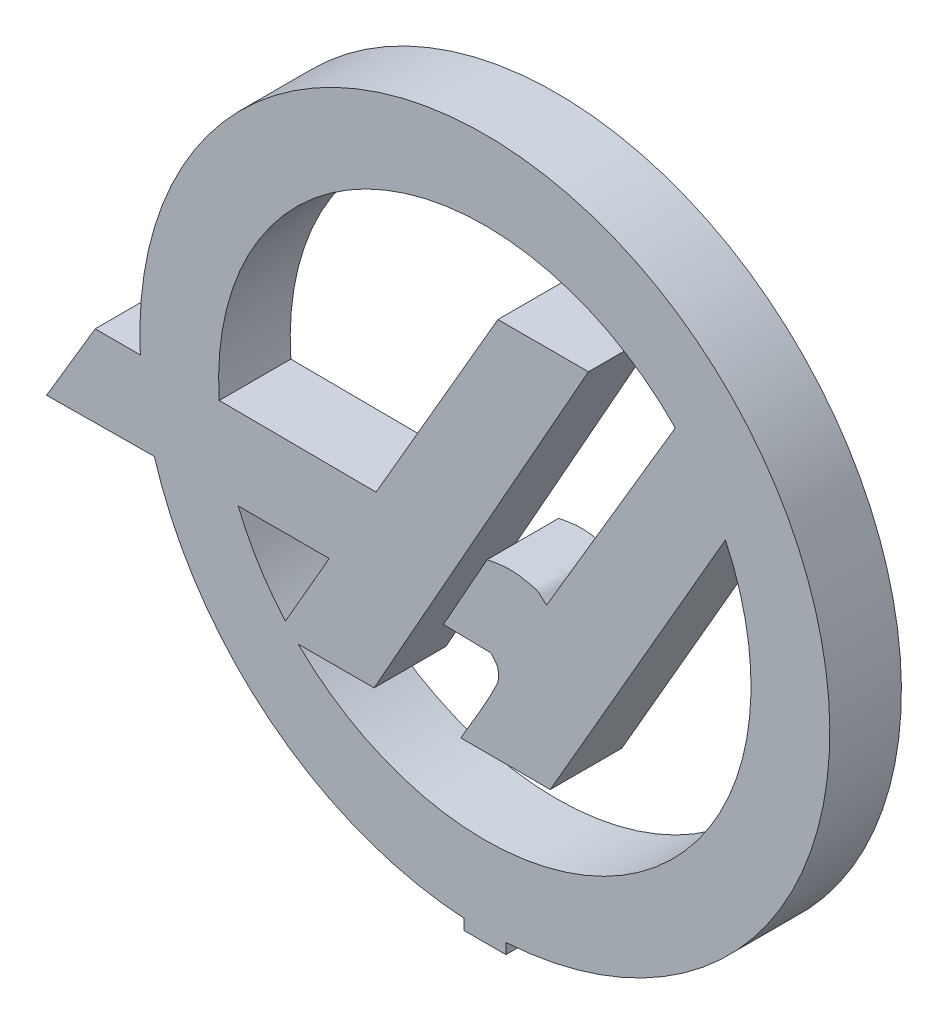
from build123d import *

# Parameters (mm, degrees)
BOSS_EXTRUDE1_DEPTH = 73.5
SCALE1_DEPTH        = 73.5
SCALE1_2_DEPTH      = 35.280051018
SCALE1_START        = 38.220051018
SCALE1_3_DEPTH      = 35.279948982
SCALE1_START_2      = 35.280051018
SCALE1_4_DEPTH      = 2.94


# Read off the part's stored shape, not the designer's step: Scale1
with BuildPart() as part:
    # Sketch1 → Boss-Extrude1 (new body)
    with BuildSketch(Plane.XY):
        with BuildLine():
            Line((6.806314099, 268.000000001), (117.455941573, 268.970996138))
            ThreePointArc((117.455941573, 268.970996138), (236.688217781, 93.24688451), (435.009033459, 17.324864215))
            Line((435.009033459, 17.324864215), (435.009033459, 6.459615702))
            Line((435.009033459, 6.459615702), (478.259031844, 6.459615702))
            Line((478.259031844, 6.459615702), (478.259031844, 17.324864314))
            ThreePointArc((478.259031844, 17.324864314), (692.344362554, 635.090638807), (103.00000551, 352))
            Line((103.00000551, 352), (56.640547879, 352))
            Line((56.640547879, 352), (6.806314099, 268.000000001))
        make_face()
        with BuildLine():
            ThreePointArc((251.884299831, 189.799453042), (224.339726467, 226.845833922), (203.423883848, 268.000000001))
            Line((203.423883848, 268.000000001), (297, 268.000000001))
            Line((297, 268.000000001), (251.884299831, 189.799453042))
        make_face(mode=Mode.SUBTRACT)
        with BuildLine():
            ThreePointArc((183.999999995, 352.000000012), (344.926101955, 620.204516968), (652.184505988, 561.696856288))
            Line((652.184505988, 561.696856288), (520, 338))
            add(Edge.make_bspline(
                [(520, 338), (516, 341), (512.856486558, 345.810656353), (508, 347), (483.294181497, 353.050404531), (477.851743634, 351.141957272), (459, 348)],
                knots=[0, 0, 0, 0, 1, 1, 1, 2, 2, 2, 2], degree=3))
            Line((459, 348), (414.15311107, 268.000000001))
            Line((414.15311107, 268.000000001), (463, 267))
            add(Edge.make_bspline(
                [(463, 267), (465.333333333, 263.666666667), (469.050440025, 260.956499894), (470, 257), (471.16945492, 252.127271165), (471.128314939, 246.536671316), (469, 242), (458.288028235, 219.166586501), (444.333333333, 198), (432, 176)],
                knots=[0, 0, 0, 0, 1, 1, 1, 2, 2, 2, 3, 3, 3, 3], degree=3))
            Line((432, 176), (523.783724069, 176))
            Line((523.783724069, 176), (703.607534398, 487.787583679))
            ThreePointArc((703.607534398, 487.787583679), (614.979125151, 148.065376335), (264.996930573, 175.96943637))
            Line((264.996930573, 175.96943637), (342.999405137, 176))
            Line((342.999405137, 176), (562.999999995, 567.000000012))
            Line((562.999999995, 567.000000012), (470.080751257, 567.000000012))
            Line((470.080751257, 567.000000012), (344.999999995, 351.000000012))
            Line((344.999999995, 351.000000012), (183.999999995, 352.000000012))
        make_face(mode=Mode.SUBTRACT)
    extrude(amount=BOSS_EXTRUDE1_DEPTH)

    # Scale1 outline → Scale1 (cut)
    # profile 1 of 3: a face of its own
    with BuildSketch(Plane.XY):
        with BuildLine():
            Line((56.640547879, 352), (6.806314099, 268.000000001))
            Line((6.806314099, 268.000000001), (117.455941573, 268.970996138))
            ThreePointArc((117.455941573, 268.970996138), (236.688217781, 93.24688451), (435.009033459, 17.324864215))
            Line((435.009033459, 17.324864215), (435.009033459, 6.459615702))
            Line((435.009033459, 6.459615702), (478.259031844, 6.459615702))
            Line((478.259031844, 6.459615702), (478.259031844, 17.324864314))
            ThreePointArc((478.259031844, 17.324864314), (692.344362554, 635.090638807), (103.00000551, 352))
            Line((103.00000551, 352), (56.640547879, 352))
        make_face()
        with BuildLine():
            Line((297, 268.000000001), (251.884299831, 189.799453042))
            ThreePointArc((251.884299831, 189.799453042), (224.339726467, 226.845833922), (203.423883848, 268.000000001))
            Line((203.423883848, 268.000000001), (297, 268.000000001))
        make_face(mode=Mode.SUBTRACT)
        with BuildLine():
            Line((342.999405137, 176), (440.814885411, 349.844315344))
            ThreePointArc((440.814885411, 349.844315344), (436.261690591, 353.400375377), (433.507038576, 358.478666261))
            Line((433.507038576, 358.478666261), (429.081053477, 358.439826415))
            Line((429.081053477, 358.439826415), (431.074422829, 361.799826415))
            Line((431.074422829, 361.799826415), (432.928801134, 361.799826415))
            ThreePointArc((432.928801134, 361.799826415), (439.934134004, 374.785953816), (454.686461757, 374.497823008))
            Line((454.686461757, 374.497823008), (562.999999995, 567.000000012))
            Line((562.999999995, 567.000000012), (470.080751257, 567.000000012))
            Line((470.080751257, 567.000000012), (344.999999995, 351.000000012))
            Line((344.999999995, 351.000000012), (183.999999995, 352.000000012))
            ThreePointArc((183.999999995, 352.000000012), (344.926101955, 620.204516968), (652.184505988, 561.696856288))
            Line((652.184505988, 561.696856288), (520, 338))
            add(Edge.make_bspline(
                [(520, 338), (516, 341), (512.856486558, 345.810656353), (508, 347), (483.294181497, 353.050404531), (477.851743634, 351.141957272), (459, 348)],
                knots=[0, 0, 0, 0, 1, 1, 1, 2, 2, 2, 2], degree=3))
            Line((459, 348), (414.15311107, 268.000000001))
            Line((414.15311107, 268.000000001), (463, 267))
            add(Edge.make_bspline(
                [(463, 267), (465.333333333, 263.666666667), (469.050440025, 260.956499894), (470, 257), (471.16945492, 252.127271165), (471.128314939, 246.536671316), (469, 242), (458.288028235, 219.166586501), (444.333333333, 198), (432, 176)],
                knots=[0, 0, 0, 0, 1, 1, 1, 2, 2, 2, 3, 3, 3, 3], degree=3))
            Line((432, 176), (523.783724069, 176))
            Line((523.783724069, 176), (703.607534398, 487.787583679))
            ThreePointArc((703.607534398, 487.787583679), (614.979125151, 148.065376335), (264.996930573, 175.96943637))
            Line((264.996930573, 175.96943637), (342.999405137, 176))
        make_face(mode=Mode.SUBTRACT)
    # profile 2 of 3: a face of its own
    with BuildSketch(Plane.XY):
        with BuildLine():
            ThreePointArc((436.945756267, 358.439826415), (437.782389972, 356.793659772), (438.884172907, 355.311804537))
            Line((438.884172907, 355.311804537), (440.688800913, 358.439826415))
            Line((440.688800913, 358.439826415), (436.945756267, 358.439826415))
        make_face()
    # profile 3 of 3: a face of its own
    with BuildSketch(Plane.XY):
        with BuildLine():
            Line((442.403869561, 352.668365901), (445.648100754, 358.434233932))
            Line((445.648100754, 358.434233932), (445.374925356, 358.439826415))
            Line((445.374925356, 358.439826415), (447.168800913, 361.639826415))
            add(Edge.make_bspline(
                [(447.481708826, 361.693046739), (447.386829266, 361.677100653), (447.284083229, 361.659040134), (447.168800913, 361.639826415)],
                knots=[1.847119824, 1.847119824, 1.847119824, 1.847119824, 2, 2, 2, 2], degree=3))
            Line((447.481708826, 361.693046739), (453.097477608, 371.673772451))
            ThreePointArc((453.097477608, 371.673772451), (441.566685859, 371.994170503), (436.168800913, 361.799826415))
            Line((436.168800913, 361.799826415), (442.608800913, 361.759826415))
            Line((442.608800913, 361.759826415), (447.612030964, 370.399826416))
            Line((447.612030964, 370.399826416), (451.328800913, 370.399826416))
            Line((451.328800913, 370.399826416), (442.528777119, 354.759826415))
            Line((442.528777119, 354.759826415), (439.408678136, 354.75860387))
            ThreePointArc((439.408678136, 354.75860387), (440.818355265, 353.587502585), (442.403869561, 352.668365901))
        make_face()
    extrude(amount=SCALE1_DEPTH, mode=Mode.SUBTRACT)

    # Scale1 2 outline → Scale1 2 (cut)
    # profile 1 of 2: a face of its own
    with BuildSketch(Plane.XY):
        with BuildLine():
            Line((445.374925356, 358.439826415), (445.648100754, 358.434233932))
            Line((445.648100754, 358.434233932), (447.481708826, 361.693046739))
            add(Edge.make_bspline(
                [(447.481708826, 361.693046739), (447.386829266, 361.677100653), (447.284083229, 361.659040134), (447.168800913, 361.639826415)],
                knots=[1.847119824, 1.847119824, 1.847119824, 1.847119824, 2, 2, 2, 2], degree=3))
            Line((447.168800913, 361.639826415), (445.374925356, 358.439826415))
        make_face()
    # profile 2 of 2: a face of its own
    with BuildSketch(Plane.XY):
        with BuildLine():
            Line((440.814885411, 349.844315344), (442.403869561, 352.668365901))
            ThreePointArc((442.403869561, 352.668365901), (440.818355265, 353.587502585), (439.408678136, 354.75860387))
            Line((439.408678136, 354.75860387), (442.528777119, 354.759826415))
            Line((442.528777119, 354.759826415), (451.328800913, 370.399826416))
            Line((451.328800913, 370.399826416), (447.612030964, 370.399826416))
            Line((447.612030964, 370.399826416), (442.608800913, 361.759826415))
            Line((442.608800913, 361.759826415), (436.168800913, 361.799826415))
            ThreePointArc((436.168800913, 361.799826415), (441.566685859, 371.994170503), (453.097477608, 371.673772451))
            Line((453.097477608, 371.673772451), (454.686461757, 374.497823008))
            ThreePointArc((454.686461757, 374.497823008), (439.934134004, 374.785953816), (432.928801134, 361.799826415))
            Line((432.928801134, 361.799826415), (431.074422829, 361.799826415))
            Line((431.074422829, 361.799826415), (429.081053477, 358.439826415))
            Line((429.081053477, 358.439826415), (433.507038576, 358.478666261))
            ThreePointArc((433.507038576, 358.478666261), (436.261690591, 353.400375377), (440.814885411, 349.844315344))
        make_face()
        with BuildLine():
            Line((440.688800913, 358.439826415), (438.884172907, 355.311804537))
            ThreePointArc((438.884172907, 355.311804537), (437.782389972, 356.793659772), (436.945756267, 358.439826415))
            Line((436.945756267, 358.439826415), (440.688800913, 358.439826415))
        make_face(mode=Mode.SUBTRACT)
    extrude(amount=SCALE1_2_DEPTH, mode=Mode.SUBTRACT)

    # Scale1 3 outline → Scale1 3 (cut)
    # profile 1 of 2: a face of its own
    with BuildSketch(Plane.XY.offset(SCALE1_START)):
        with BuildLine():
            Line((445.374925356, 358.439826415), (445.648100754, 358.434233932))
            Line((445.648100754, 358.434233932), (447.481708826, 361.693046739))
            add(Edge.make_bspline(
                [(447.481708826, 361.693046739), (447.386829266, 361.677100653), (447.284083229, 361.659040134), (447.168800913, 361.639826415)],
                knots=[1.847119824, 1.847119824, 1.847119824, 1.847119824, 2, 2, 2, 2], degree=3))
            Line((447.168800913, 361.639826415), (445.374925356, 358.439826415))
        make_face()
    # profile 2 of 2: a face of its own
    with BuildSketch(Plane.XY.offset(SCALE1_START)):
        with BuildLine():
            Line((440.814885411, 349.844315344), (442.403869561, 352.668365901))
            ThreePointArc((442.403869561, 352.668365901), (440.818355265, 353.587502585), (439.408678136, 354.75860387))
            Line((439.408678136, 354.75860387), (442.528777119, 354.759826415))
            Line((442.528777119, 354.759826415), (451.328800913, 370.399826416))
            Line((451.328800913, 370.399826416), (447.612030964, 370.399826416))
            Line((447.612030964, 370.399826416), (442.608800913, 361.759826415))
            Line((442.608800913, 361.759826415), (436.168800913, 361.799826415))
            ThreePointArc((436.168800913, 361.799826415), (441.566685859, 371.994170503), (453.097477608, 371.673772451))
            Line((453.097477608, 371.673772451), (454.686461757, 374.497823008))
            ThreePointArc((454.686461757, 374.497823008), (439.934134004, 374.785953816), (432.928801134, 361.799826415))
            Line((432.928801134, 361.799826415), (431.074422829, 361.799826415))
            Line((431.074422829, 361.799826415), (429.081053477, 358.439826415))
            Line((429.081053477, 358.439826415), (433.507038576, 358.478666261))
            ThreePointArc((433.507038576, 358.478666261), (436.261690591, 353.400375377), (440.814885411, 349.844315344))
        make_face()
        with BuildLine():
            Line((440.688800913, 358.439826415), (438.884172907, 355.311804537))
            ThreePointArc((438.884172907, 355.311804537), (437.782389972, 356.793659772), (436.945756267, 358.439826415))
            Line((436.945756267, 358.439826415), (440.688800913, 358.439826415))
        make_face(mode=Mode.SUBTRACT)
    extrude(amount=SCALE1_3_DEPTH, mode=Mode.SUBTRACT)

    # Scale1 4 outline → Scale1 4 (add)
    with BuildSketch(Plane.XY.offset(SCALE1_START_2)):
        with BuildLine():
            Line((445.648100754, 358.434233932), (447.328800913, 358.399826415))
            add(Edge.make_bspline(
                [(447.328800913, 358.399826415), (447.422134247, 358.266493082), (447.570818514, 358.158086411), (447.608800913, 357.999826415), (447.65557911, 357.804917262), (447.653933511, 357.581293268), (447.568800913, 357.399826415), (447.140322043, 356.486489875), (446.582134247, 355.639826415), (446.088800913, 354.759826415)],
                knots=[0, 0, 0, 0, 1, 1, 1, 2, 2, 2, 3, 3, 3, 3], degree=3))
            Line((446.088800913, 354.759826415), (449.760149876, 354.759826415))
            Line((449.760149876, 354.759826415), (456.953102289, 367.231329762))
            ThreePointArc((456.953102289, 367.231329762), (454.807368588, 354.825801091), (442.403869561, 352.668365901))
            Line((442.403869561, 352.668365901), (440.814885411, 349.844315344))
            ThreePointArc((440.814885411, 349.844315344), (443.440827123, 348.860278768), (446.209162252, 348.412820984))
            Line((446.209162252, 348.412820984), (446.209162252, 347.978211043))
            Line((446.209162252, 347.978211043), (447.939162187, 347.978211043))
            Line((447.939162187, 347.978211043), (447.939162187, 348.412820988))
            ThreePointArc((447.939162187, 348.412820988), (460.788132604, 359.004380005), (454.686461757, 374.497823008))
            Line((454.686461757, 374.497823008), (453.097477608, 371.673772451))
            ThreePointArc((453.097477608, 371.673772451), (454.036591605, 370.978863746), (454.896181153, 370.187700667))
            Line((454.896181153, 370.187700667), (449.608800913, 361.239826415))
            add(Edge.make_bspline(
                [(449.608800913, 361.239826415), (449.448800913, 361.359826415), (449.323060376, 361.552252669), (449.128800913, 361.599826415), (448.291649369, 361.80484312), (448.007443145, 361.781405124), (447.481708826, 361.693046739)],
                knots=[0, 0, 0, 0, 1, 1, 1, 1.847119824, 1.847119824, 1.847119824, 1.847119824], degree=3))
            Line((447.481708826, 361.693046739), (445.648100754, 358.434233932))
        make_face()
    extrude(amount=SCALE1_4_DEPTH)


solid = part.part
